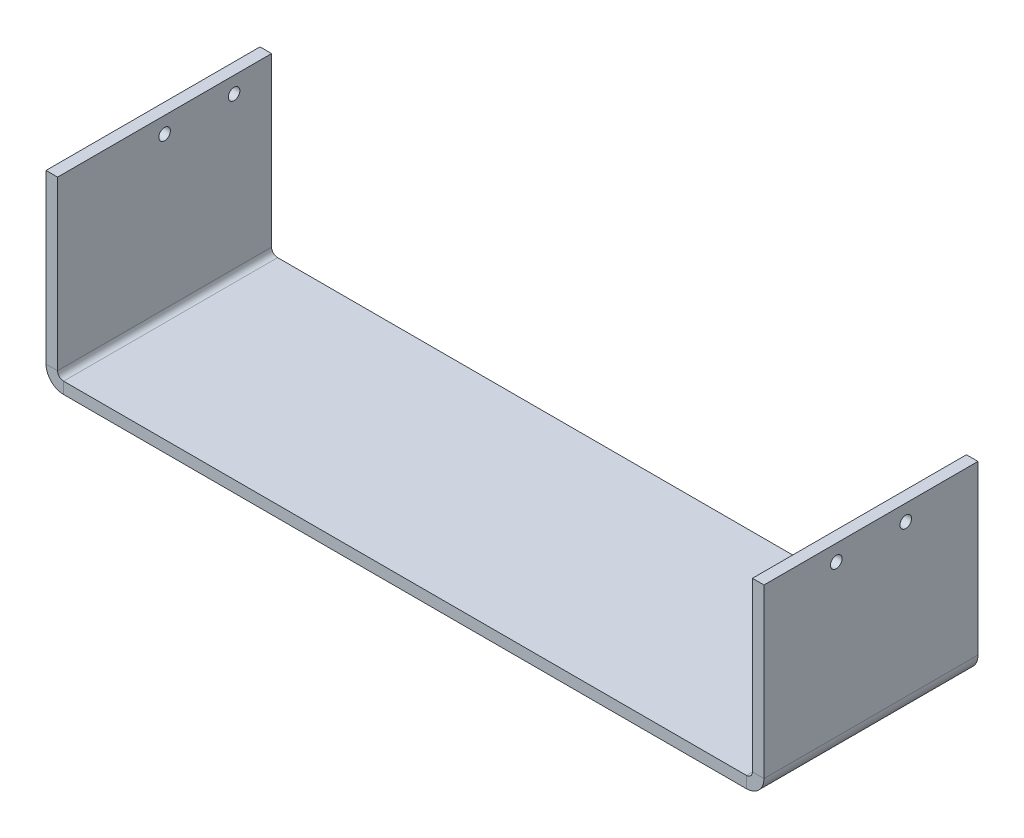
from build123d import *

# Parameters (mm, degrees)
BASE_FLANGE1_DEPTH = 92.4
SKETCH6_R          = 2.5
CUT_EXTRUDE1_DEPTH = 10
SKETCH7_R          = 2.5
CUT_EXTRUDE2_DEPTH = 10


# Sheet-metal steps are written as plain solids
with BuildPart() as part:
    # Sketch1 → Base-Flange1 (new body)
    with BuildSketch(Plane.XY):
        with BuildLine():
            Line((0, 0), (0, -72.4))
            ThreePointArc((0, -72.4), (-2.225988463, -77.774011537), (-7.6, -80))
            Line((-7.6, -80), (-130, -80))
            Line((-130, -80), (-230, -80))
            Line((-230, -80), (-302.4, -80))
            ThreePointArc((-302.4, -80), (-307.774011537, -77.774011537), (-310, -72.4))
            Line((-310, -72.4), (-310, 0))
            Line((-310, 0), (-305, 0))
            Line((-305, 0), (-305, -72.4))
            ThreePointArc((-305, -72.4), (-304.238477631, -74.238477631), (-302.4, -75))
            Line((-302.4, -75), (-230, -75))
            Line((-230, -75), (-130, -75))
            Line((-130, -75), (-7.6, -75))
            ThreePointArc((-7.6, -75), (-5.761522369, -74.238477631), (-5, -72.4))
            Line((-5, -72.4), (-5, 0))
            Line((-5, 0), (0, 0))
        make_face()
    extrude(amount=BASE_FLANGE1_DEPTH)

    # Sketch6 → Cut-Extrude1 (cut)
    with BuildSketch(Plane(origin=(0, 0, 0), x_dir=(0, 0, -1), z_dir=(1, 0, 0))):
        with Locations((-61.2, -7)):
            Circle(SKETCH6_R)
        with Locations((-31.2, -7)):
            Circle(SKETCH6_R)
    extrude(amount=-CUT_EXTRUDE1_DEPTH, mode=Mode.SUBTRACT)

    # Sketch7 → Cut-Extrude2 (cut)
    with BuildSketch(Plane.ZY.offset(310)):
        with Locations((46.2, -7)):
            Circle(SKETCH7_R)
        with Locations((16.2, -7)):
            Circle(SKETCH7_R)
    extrude(amount=-CUT_EXTRUDE2_DEPTH, mode=Mode.SUBTRACT)


solid = part.part
